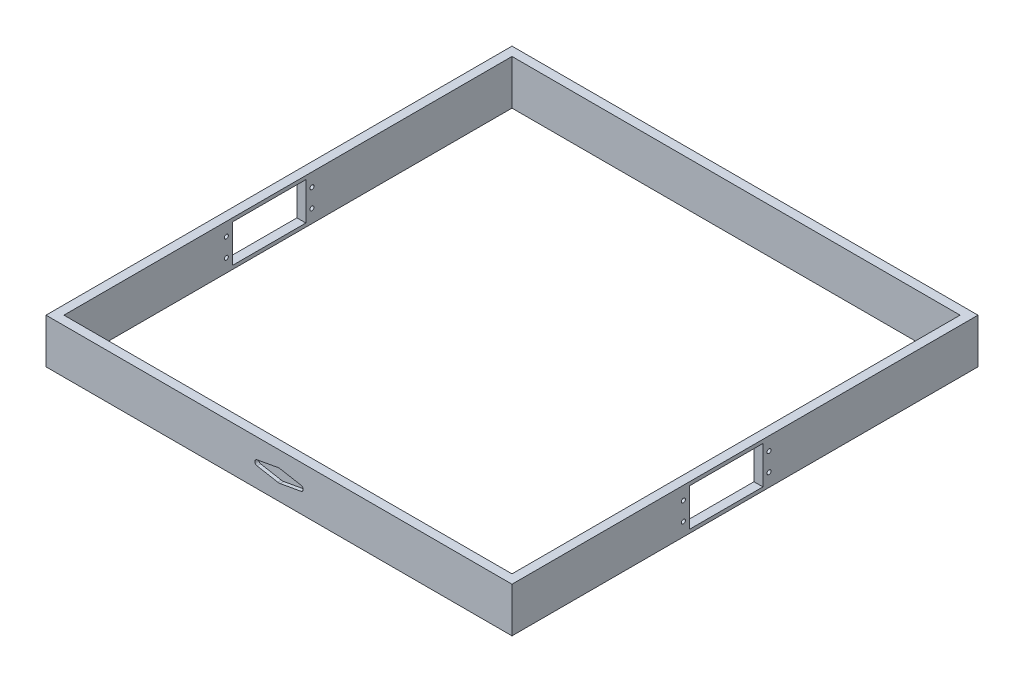
from build123d import *

# Parameters (mm, degrees)
SKETCH1_W                                  = 260.2
SKETCH1_H                                  = 260.2
BOSS_EXTRUDE1_DEPTH                        = 25
SKETCH2_W                                  = 250.2
SKETCH2_H                                  = 250.2
CUT_EXTRUDE1_DEPTH                         = 25
SKETCH19_W                                 = 41
SKETCH19_H                                 = 21
CUT_EXTRUDE10_DEPTH                        = 292.984674255
SKETCH21_R                                 = 1.125
CUT_EXTRUDE12_DEPTH                        = 292.984674255
MIRROR1_AT_THE_SECOND_PLANE_COPY_1_SKETC_R = 1.125
MIRROR1_AT_THE_SECOND_PLANE_COPY_1_DEPTH   = 292.984674255
CUT_EXTRUDE13_DEPTH                        = 2


with BuildPart() as part:
    # Sketch1 → Boss-Extrude1 (new body)
    with BuildSketch(Plane(origin=(0, 0, 0), x_dir=(1, 0, 0), z_dir=(0, 1, 0))):
        Rectangle(SKETCH1_W, SKETCH1_H)
    extrude(amount=BOSS_EXTRUDE1_DEPTH)

    # Sketch2 → Cut-Extrude1 (cut)
    with BuildSketch(Plane(origin=(0, 25, 0), x_dir=(1, 0, 0), z_dir=(0, 1, 0))):
        Rectangle(SKETCH2_W, SKETCH2_H)
    extrude(amount=-CUT_EXTRUDE1_DEPTH, mode=Mode.SUBTRACT)

    # Sketch19 → Cut-Extrude10 (cut, through all)
    with BuildSketch(Plane.ZY.offset(130.1)):
        with Locations((10.5, 12.5)):
            Rectangle(SKETCH19_W, SKETCH19_H)
    extrude(amount=-CUT_EXTRUDE10_DEPTH, mode=Mode.SUBTRACT)

    # Sketch21 → Cut-Extrude12 (cut, through all)
    with BuildSketch(Plane.ZY.offset(130.1)):
        with Locations((-13.4, 17.6)):
            Circle(SKETCH21_R)
    cut_extrude12 = extrude(amount=-CUT_EXTRUDE12_DEPTH, mode=Mode.SUBTRACT)

    # Mirror1: Cut-Extrude12 across plane
    add(cut_extrude12.mirror(Plane.XY.offset(10.5)), mode=Mode.SUBTRACT)

    # Mirror1 at the second plane: Cut-Extrude12 across plane
    add(cut_extrude12.mirror(Plane.ZX.offset(12.5)), mode=Mode.SUBTRACT)

    # Mirror1 at the second plane copy 1 sketc → Mirror1 at the second plane copy 1 (cut, through all)
    with BuildSketch(Plane(origin=(-130.1, 25, 21), x_dir=(0, 0, -1), z_dir=(-1, 0, 0))):
        with Locations((-13.4, 17.6)):
            Circle(MIRROR1_AT_THE_SECOND_PLANE_COPY_1_SKETC_R)
    extrude(amount=-MIRROR1_AT_THE_SECOND_PLANE_COPY_1_DEPTH, mode=Mode.SUBTRACT)

    # Sketch22 → Cut-Extrude13 (cut)
    with BuildSketch(Plane.XY.offset(130.1)):
        with BuildLine():
            Line((-12.26625, 13.976181201), (-0.644325, 16.072358506))
            ThreePointArc((-0.644325, 16.072358506), (0, 16.13), (0.644325, 16.072358506))
            Line((0.644325, 16.072358506), (12.26625, 13.976181201))
            ThreePointArc((12.26625, 13.976181201), (13.5, 12.5), (12.26625, 11.023818799))
            Line((12.26625, 11.023818799), (0.644325, 8.927641494))
            ThreePointArc((0.644325, 8.927641494), (0, 8.87), (-0.644325, 8.927641494))
            Line((-0.644325, 8.927641494), (-12.26625, 11.023818799))
            ThreePointArc((-12.26625, 11.023818799), (-13.5, 12.5), (-12.26625, 13.976181201))
        make_face()
    cut_extrude13 = extrude(amount=-CUT_EXTRUDE13_DEPTH, mode=Mode.SUBTRACT)

    # Mirror2: Cut-Extrude13 across plane
    add(cut_extrude13.mirror(Plane.XY), mode=Mode.SUBTRACT)


solid = part.part
